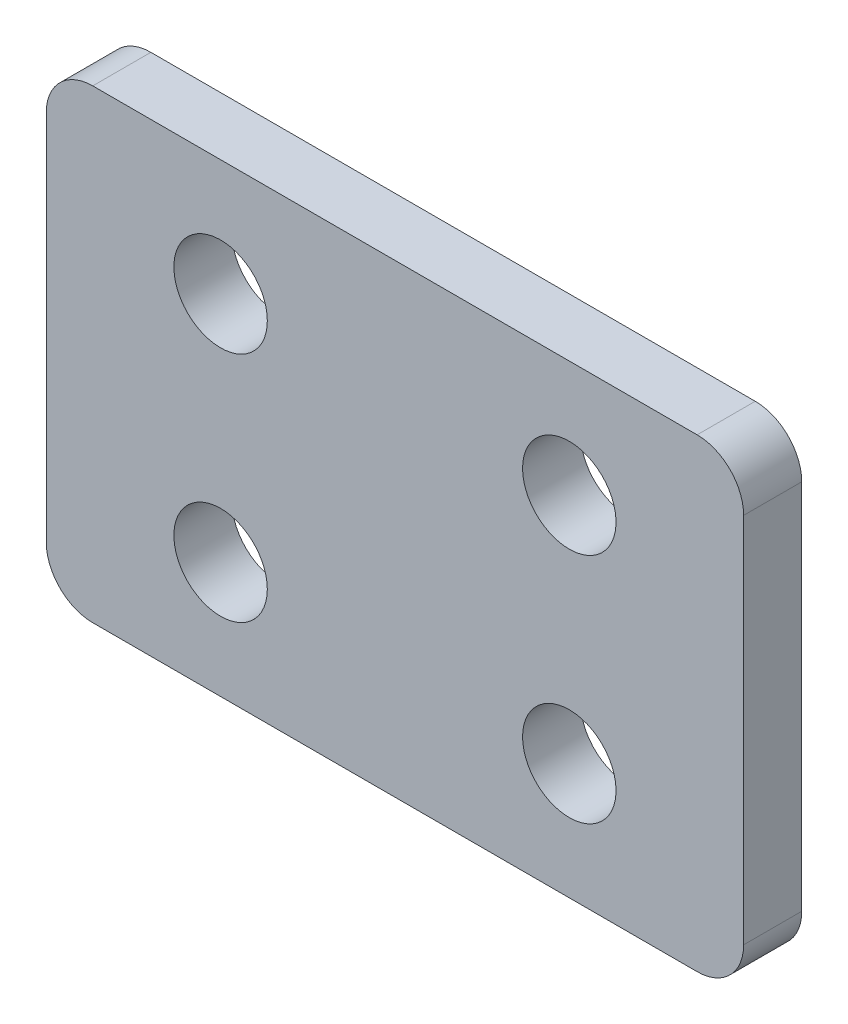
from build123d import *

# Parameters (mm, degrees)
SKETCH1_W           = 38.1
SKETCH1_H           = 25.4
SKETCH1_R           = 2.5527
BOSS_EXTRUDE1_DEPTH = 3.175
FILLET1_R           = 2.54


with BuildPart() as part:
    # Sketch1 → Boss-Extrude1 (new body)
    with BuildSketch(Plane.XY):
        Rectangle(SKETCH1_W, SKETCH1_H)
        with Locations((-9.525, -6.35)):
            Circle(SKETCH1_R, mode=Mode.SUBTRACT)
        with Locations((-9.525, 6.35)):
            Circle(SKETCH1_R, mode=Mode.SUBTRACT)
        with Locations((9.525, -6.35)):
            Circle(SKETCH1_R, mode=Mode.SUBTRACT)
        with Locations((9.525, 6.35)):
            Circle(SKETCH1_R, mode=Mode.SUBTRACT)
    extrude(amount=BOSS_EXTRUDE1_DEPTH)

    # Fillet1
    fillet1_edges = [part.edges().sort_by_distance(p)[0] for p in [
        (-19.05, 12.7, 1.5875),
        (-19.05, -12.7, 1.5875),
        (19.05, -12.7, 1.5875),
        (19.05, 12.7, 1.5875),
    ]]
    fillet(fillet1_edges, radius=FILLET1_R)


solid = part.part
